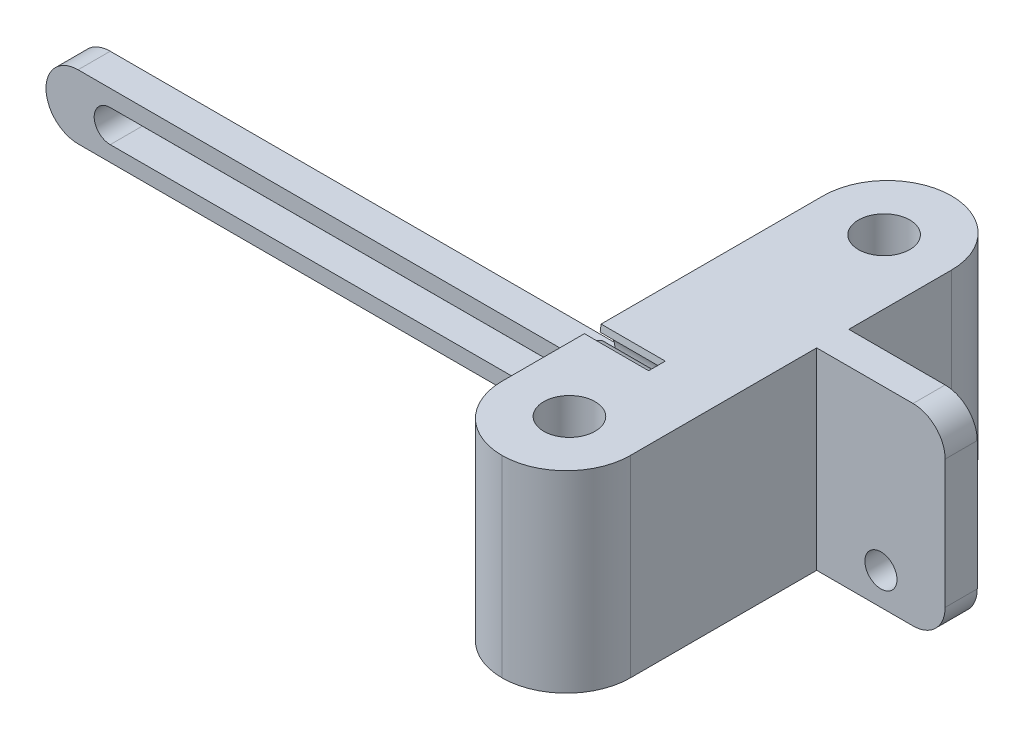
from build123d import *

# Parameters (mm, degrees)
SKETCH2_W                = 20
SKETCH2_H                = 70
BOSS_EXTRUDE1_DEPTH      = 30
SKETCH3_R                = 4
CUT_EXTRUDE1_DEPTH       = 20
SKETCH4_R                = 2.5
CUT_EXTRUDE2_DEPTH       = 10
FILLET1_R                = 10
BOSS_EXTRUDE2_DEPTH      = 100
BOSS_EXTRUDE2_DEPTH_BACK = 40
SKETCH5_W                = 5
SKETCH5_H                = 30
SKETCH6_R                = 2.5
SKETCH6_W                = 100
SKETCH6_H                = 20
CUT_EXTRUDE3_DEPTH       = 5
FILLET2_R                = 5
CUT_EXTRUDE5_REACH       = 132.074
SKETCH8_W                = 6
SKETCH8_H                = 10


with BuildPart() as part:
    # Sketch2 → Boss-Extrude1 (new body)
    with BuildSketch(Plane(origin=(0, 0, 0), x_dir=(1, 0, 0), z_dir=(0, 1, 0))):
        with Locations((6.47761194, -5.23880597)):
            Rectangle(SKETCH2_W, SKETCH2_H)
    extrude(amount=BOSS_EXTRUDE1_DEPTH)

    # Sketch3 → Cut-Extrude1 (cut)
    with BuildSketch(Plane(origin=(0, 30, 0), x_dir=(1, 0, 0), z_dir=(0, 1, 0))):
        with Locations(Location((6.47761194, 19.26119403, 0), (0, 0, 270))):
            Circle(SKETCH3_R)
        with Locations(Location((6.47761194, -29.73880597, 0), (0, 0, 270))):
            Circle(SKETCH3_R)
    extrude(amount=-CUT_EXTRUDE1_DEPTH, mode=Mode.SUBTRACT)

    # Sketch4 → Cut-Extrude2 (cut)
    with BuildSketch(Plane.ZY.offset(3.52238806)):
        with BuildLine():
            Line((17.415034126, 30.126407987), (14.795699792, 30.126407987))
            Line((14.795699792, 30.126407987), (14.949961333, 28.969446425))
            ThreePointArc((14.949961333, 28.969446425), (16.17927412, 22.186618473), (17.347611009, 28.980215007))
            Line((17.347611009, 28.980215007), (17.415034126, 30.126407987))
        make_face()
        with Locations((16.163554702, 25.686583173)):
            Circle(SKETCH4_R, mode=Mode.SUBTRACT)
    extrude(amount=-CUT_EXTRUDE2_DEPTH, mode=Mode.SUBTRACT)

    # Fillet1
    fillet1_edges = [part.edges().sort_by_distance(p)[0] for p in [
        (-3.52238806, 15, -29.76119403),
        (16.47761194, 15, -29.76119403),
        (16.47761194, 15, 40.23880597),
        (-3.52238806, 15, 40.23880597),
    ]]
    fillet(fillet1_edges, radius=FILLET1_R - 0.0001)  # a hair under: the kernel refuses the full size

    # Sketch5 → Boss-Extrude2 (add, two sides: drawn at the far end of the back side and taken through both)
    with BuildSketch(Plane.ZY.offset(3.52238806).offset(-BOSS_EXTRUDE2_DEPTH_BACK)):
        with Locations((-1.26119403, 15)):
            Rectangle(SKETCH5_W, SKETCH5_H)
    extrude(amount=BOSS_EXTRUDE2_DEPTH + BOSS_EXTRUDE2_DEPTH_BACK)

    # Sketch6 → Cut-Extrude3 (cut)
    with BuildSketch(Plane(origin=(0, 0, -3.76119403), x_dir=(-1, 0, 0), z_dir=(0, 0, -1))):
        with Locations((-26.47761194, 5)):
            Circle(SKETCH6_R)
        with Locations((53.52238806, 20)):
            Rectangle(SKETCH6_W, SKETCH6_H)
        with BuildLine():
            Line((93.519935535, 2.406805213), (-1.480064465, 2.500001203))
            ThreePointArc((-1.480064465, 2.500001203), (-3.977610737, 5.002452525), (-1.475159415, 7.499998797))
            Line((-1.475159415, 7.499998797), (93.524840585, 7.406802807))
            ThreePointArc((93.524840585, 7.406802807), (96.022386857, 4.904351485), (93.519935535, 2.406805213))
        make_face()
    extrude(amount=-CUT_EXTRUDE3_DEPTH, mode=Mode.SUBTRACT)

    # Fillet2
    fillet2_edges = [part.edges().sort_by_distance(p)[0] for p in [
        (36.47761194, 30, -1.26119403),
        (36.47761194, 0, -1.26119403),
        (-103.52238806, 10, -1.26119403),
        (-103.52238806, 0, -1.26119403),
    ]]
    fillet(fillet2_edges, radius=FILLET2_R - 0.0001)  # a hair under: the kernel refuses the full size

    # Sketch8 → Cut-Extrude5 (cut, up to next)
    with BuildSketch(Plane(origin=(16.47761194, 0, 0), x_dir=(0, 0, -1), z_dir=(1, 0, 0)), mode=Mode.PRIVATE) as cut_extrude5_sk1:
        with Locations((6.76119403, 5)):
            Rectangle(SKETCH8_W, SKETCH8_H)
    cut_extrude5_tool1 = extrude(cut_extrude5_sk1.sketch, amount=-CUT_EXTRUDE5_REACH, mode=Mode.PRIVATE) & part.part
    add(cut_extrude5_tool1.solids().sort_by_distance((16.477612, 5, -6.761194))[0], mode=Mode.SUBTRACT)


solid = part.part
